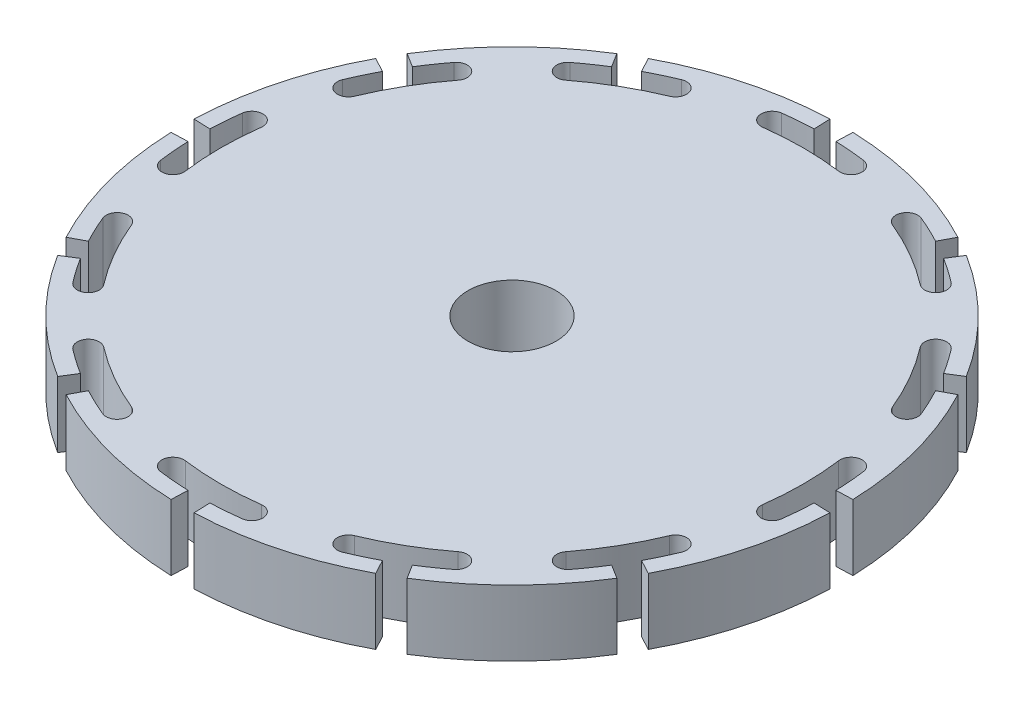
from build123d import *

# Parameters (mm, degrees)
SKETCH1_R         = 30
WHEEL_BLANK_DEPTH = 6
T_SLOT_DEPTH      = 43.848570571
CIRPATTERN1_COUNT = 12
SKETCH3_R         = 4
CENTER_HOLE_DEPTH = 6


with BuildPart() as part:
    # Sketch1 → Wheel Blank (new body)
    with BuildSketch(Plane(origin=(0, 0, 0), x_dir=(1, 0, 0), z_dir=(0, 1, 0))):
        Circle(SKETCH1_R)
    extrude(amount=WHEEL_BLANK_DEPTH)

    # Sketch2 → T-Slot (cut, through all)
    with BuildSketch(Plane(origin=(0, 0, 0), x_dir=(1, 0, 0), z_dir=(0, 1, 0))):
        with BuildLine():
            Line((-1.046984901, 29.981724811), (-0.994635656, 28.48263857))
            ThreePointArc((-0.994635656, 28.48263857), (-2.360033914, 28.402116821), (-3.719996478, 28.256178549))
            ThreePointArc((-3.719996478, 28.256178549), (-4.580915147, 27.134207496), (-3.458944094, 26.273288826))
            ThreePointArc((-3.458944094, 26.273288826), (0, 26.5), (3.458944094, 26.273288826))
            ThreePointArc((3.458944094, 26.273288826), (4.580915147, 27.134207496), (3.719996478, 28.256178549))
            ThreePointArc((3.719996478, 28.256178549), (2.360033914, 28.402116821), (0.994635656, 28.48263857))
            Line((0.994635656, 28.48263857), (1.046984901, 29.981724811))
            ThreePointArc((1.046984901, 29.981724811), (0, 30), (-1.046984901, 29.981724811))
        make_face()
    t_slot = extrude(amount=T_SLOT_DEPTH, mode=Mode.SUBTRACT)

    # CirPattern1: T-Slot ×12 about axis
    cirpattern1_axis = Axis((0, 6, 0), (0, -1, 0))
    for i in range(1, CIRPATTERN1_COUNT):
        add(t_slot.rotate(cirpattern1_axis, i * 360 / CIRPATTERN1_COUNT), mode=Mode.SUBTRACT)

    # Sketch3 → Center Hole (cut)
    with BuildSketch(Plane(origin=(0, 0, 0), x_dir=(1, 0, 0), z_dir=(0, 1, 0))):
        Circle(SKETCH3_R)
    extrude(amount=CENTER_HOLE_DEPTH, mode=Mode.SUBTRACT)


solid = part.part
